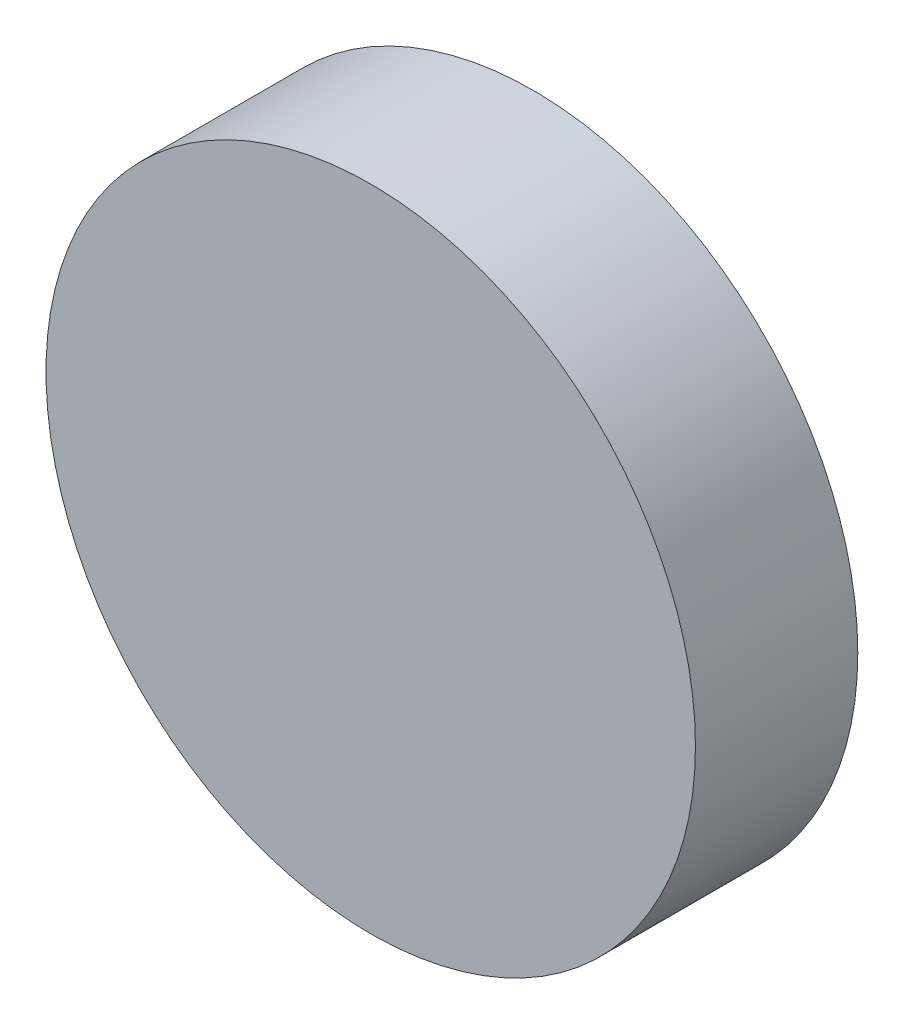
from build123d import *

# Parameters (mm, degrees)
EXTRUDE_160_40_DEPTH      = 20
EXTRUDE_160_40_DEPTH_BACK = 20
SKETCH_1_R                = 80


with BuildPart() as part:
    # Эскиз1 → Колесо Ø160 × 40 (упрощено) (new, two sides: drawn at the far end of the back side and taken through both)
    with BuildSketch(Plane.XY.offset(-EXTRUDE_160_40_DEPTH_BACK)):
        Circle(SKETCH_1_R)
    extrude(amount=EXTRUDE_160_40_DEPTH + EXTRUDE_160_40_DEPTH_BACK)


solid = part.part
